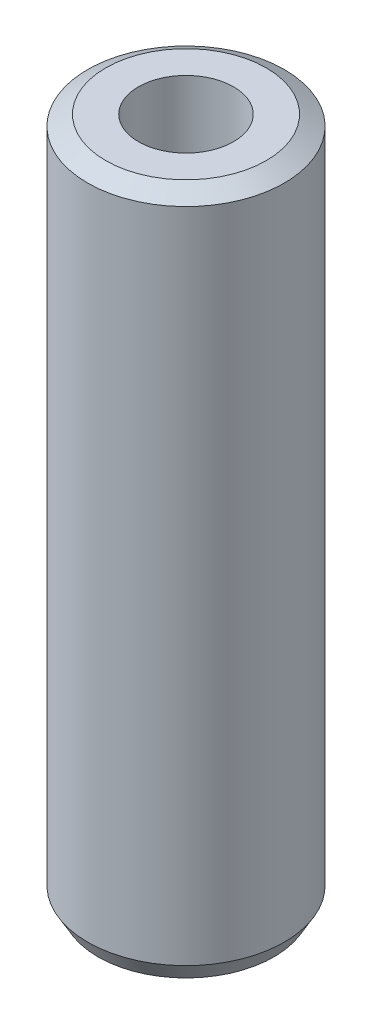
from build123d import *
from OCP.BRepFilletAPI import BRepFilletAPI_MakeChamfer

# Parameters (mm, degrees)
SKETCH1_R           = 35
BOSS_EXTRUDE1_DEPTH = 244.042978867
SKETCH2_R           = 16.935083165
CUT_EXTRUDE1_DEPTH  = 250.011998776
CHAMFER1_SIZE       = 3.706524892
CHAMFER1_SIZE2      = 6.419889433


with BuildPart() as part:
    # Sketch1 → Boss-Extrude1 (new body)
    with BuildSketch(Plane(origin=(0, 0, 0), x_dir=(1, 0, 0), z_dir=(0, 1, 0))):
        Circle(SKETCH1_R)
    extrude(amount=BOSS_EXTRUDE1_DEPTH)

    # Sketch2 → Cut-Extrude1 (cut, through all)
    with BuildSketch(Plane(origin=(0, 0, 0), x_dir=(1, 0, 0), z_dir=(0, 1, 0))):
        Circle(SKETCH2_R)
    extrude(amount=CUT_EXTRUDE1_DEPTH, mode=Mode.SUBTRACT)

    # Chamfer1: one chamfer whose edges measure the first distance from different faces: ONE call of the kernel's chamfer builder (chamfer() names one face for all edges)
    chamfer1_edges_1 = [part.edges().sort_by_distance(p)[0] for p in [
        (-35, 244.042978867, 0),
    ]]
    chamfer1_side_1 = [part.faces().sort_by_distance(p)[0] for p in [
        (-35, 122.021489433, 0),
    ]]
    chamfer1_edges_2 = [part.edges().sort_by_distance(p)[0] for p in [
        (-35, 0, 0),
    ]]
    chamfer1_side_2 = [part.faces().sort_by_distance(p)[0] for p in [
        (-34.010050506, 0, 0),
    ]]
    chamfer1 = BRepFilletAPI_MakeChamfer(part.part.solid().wrapped)
    for e in chamfer1_edges_1:
        chamfer1.Add(CHAMFER1_SIZE, CHAMFER1_SIZE2, e.wrapped, chamfer1_side_1[0].wrapped)  # the first distance lies on this face
    for e in chamfer1_edges_2:
        chamfer1.Add(CHAMFER1_SIZE, CHAMFER1_SIZE2, e.wrapped, chamfer1_side_2[0].wrapped)  # the first distance lies on this face
    add(Compound.cast(chamfer1.Shape()), mode=Mode.REPLACE)


solid = part.part
